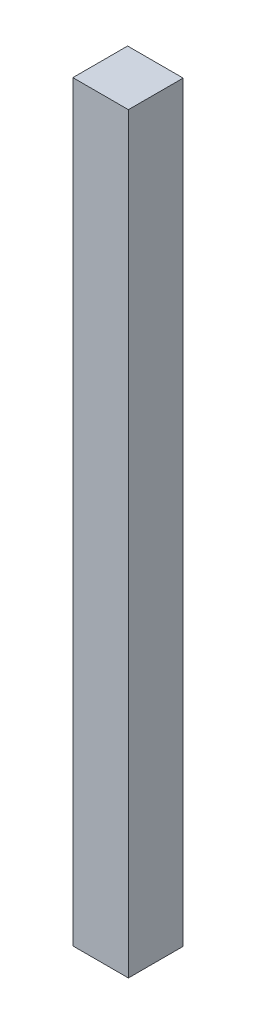
from build123d import *

# Parameters (mm, degrees)
SKETCH1_W           = 45.02
SKETCH1_H           = 44.376857142
BOSS_EXTRUDE1_DEPTH = 609.6


with BuildPart() as part:
    # Sketch1 → Boss-Extrude1 (new body)
    with BuildSketch(Plane(origin=(0, 0, 0), x_dir=(1, 0, 0), z_dir=(0, 1, 0))):
        Rectangle(SKETCH1_W, SKETCH1_H)
    extrude(amount=BOSS_EXTRUDE1_DEPTH)


solid = part.part
